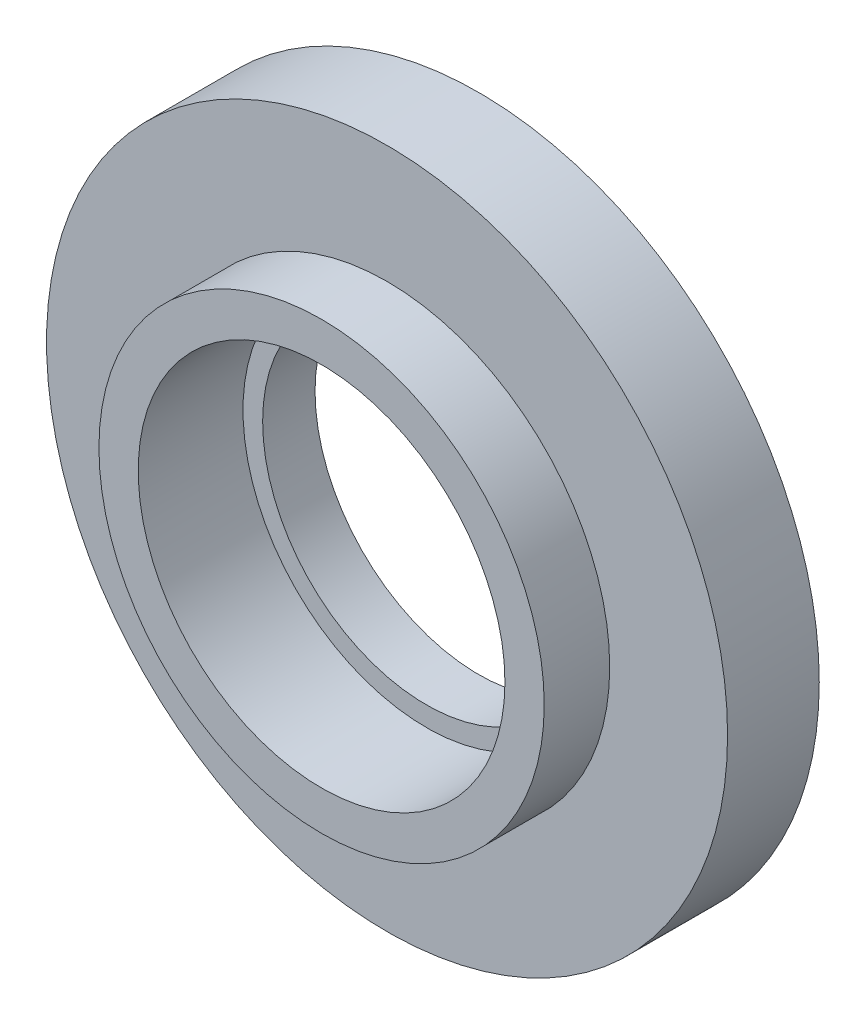
from build123d import *

# Parameters (mm, degrees)
SKETCH4_R          = 14
CUT_EXTRUDE1_DEPTH = 8
SKETCH5_R          = 12.5
CUT_EXTRUDE4_DEPTH = 8.1
SKETCH7_R          = 2.5
CUT_EXTRUDE5_DEPTH = 3


with BuildPart() as part:
    # Sketch2 → Revolve4 (revolve)
    with BuildSketch(Plane(origin=(0, 0, 0), x_dir=(1, 0, 0), z_dir=(0, 1, 0))):
        Polygon((0, 0), (-26, 0), (-26, -7), (-17, -7), (-17, -12), (0, -12), align=None)
    revolve(axis=Axis((0, 0, 12), (0, 0, -1)))

    # Sketch4 → Cut-Extrude1 (cut)
    with BuildSketch(Plane.XY.offset(12)):
        Circle(SKETCH4_R)
    extrude(amount=-CUT_EXTRUDE1_DEPTH, mode=Mode.SUBTRACT)

    # Sketch5 → Cut-Extrude4 (cut)
    with BuildSketch(Plane(origin=(0, 0, 0), x_dir=(-1, 0, 0), z_dir=(0, 0, -1))):
        Circle(SKETCH5_R)
    extrude(amount=-CUT_EXTRUDE4_DEPTH, mode=Mode.SUBTRACT)

    # Sketch7 → Cut-Extrude5 (cut)
    with BuildSketch(Plane(origin=(0, 0, 0), x_dir=(-1, 0, 0), z_dir=(0, 0, -1))):
        with Locations((0, 17)):
            Circle(SKETCH7_R)
        with Locations((14.722431864, 8.5)):
            Circle(SKETCH7_R)
        with Locations((14.722431864, -8.5)):
            Circle(SKETCH7_R)
        with Locations((0, -17)):
            Circle(SKETCH7_R)
        with Locations((-14.722431864, -8.5)):
            Circle(SKETCH7_R)
        with Locations((-14.722431864, 8.5)):
            Circle(SKETCH7_R)
    extrude(amount=-CUT_EXTRUDE5_DEPTH, mode=Mode.SUBTRACT)


solid = part.part
